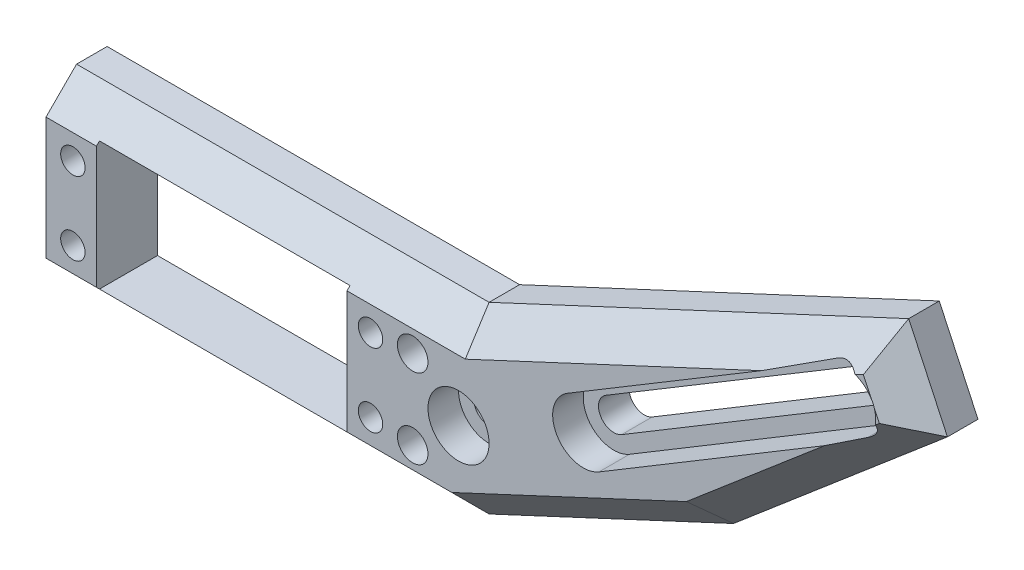
from build123d import *

# Parameters (mm, degrees)
SKETCH1_W                = 57.5
SKETCH1_H                = 30
BOSS_EXTRUDE1_DEPTH      = 30
SKETCH2_W                = 41
SKETCH2_H                = 21
CUT_EXTRUDE1_DEPTH       = 25
SKETCH8_R                = 2
CUT_EXTRUDE6_DEPTH       = 10
SKETCH10_R               = 5
CUT_EXTRUDE8_DEPTH       = 10
BOSS_EXTRUDE4_DEPTH      = 30
SKETCH16_R               = 5
CUT_EXTRUDE10_DEPTH      = 30
CHAMFER5_SIZE            = 5
SKETCH19_R               = 2.5
CUT_EXTRUDE12_DEPTH      = 30
SKETCH20_R               = 7.5
CUT_EXTRUDE13_DEPTH      = 2.5
CUT_EXTRUDE15_DEPTH      = 122.918629513
CUT_EXTRUDE15_DEPTH_BACK = 122.918629513
SKETCH29_W               = 67.5
SKETCH29_H               = 15
CUT_EXTRUDE16_DEPTH      = 124.489525441
CUT_EXTRUDE17_DEPTH      = 5
SKETCH32_R               = 5
CUT_EXTRUDE18_DEPTH      = 5


with BuildPart() as part:
    # Sketch1 → Boss-Extrude1 (new body)
    with BuildSketch(Plane.XY):
        Rectangle(SKETCH1_W, SKETCH1_H)
    extrude(amount=BOSS_EXTRUDE1_DEPTH)

    # Sketch2 → Cut-Extrude1 (cut)
    with BuildSketch(Plane.XY.offset(30)):
        Rectangle(SKETCH2_W, SKETCH2_H)
    extrude(amount=-CUT_EXTRUDE1_DEPTH, mode=Mode.SUBTRACT)

    # Sketch8 → Cut-Extrude6 (cut)
    with BuildSketch(Plane.XY.offset(30)):
        with Locations((24.35, 6)):
            Circle(SKETCH8_R)
        with Locations(Location((24.35, -6, 0), (0, 0, 180))):
            Circle(SKETCH8_R)
        with Locations((-24.35, -6)):
            Circle(SKETCH8_R)
        with Locations(Location((-24.35, 6, 0), (0, 0, 180))):
            Circle(SKETCH8_R)
    extrude(amount=-CUT_EXTRUDE6_DEPTH, mode=Mode.SUBTRACT)

    # Sketch10 → Cut-Extrude8 (cut)
    with BuildSketch(Plane.XY.offset(5)):
        with Locations((-10, 0)):
            Circle(SKETCH10_R)
    extrude(amount=-CUT_EXTRUDE8_DEPTH, mode=Mode.SUBTRACT)

    # Sketch13 → Boss-Extrude4 (add)
    with BuildSketch(Plane.XY.offset(30)):
        Polygon((28.75, 15), (38.75, 15), (107.410726074, 47.017022383), (113.75, 33.422405577), (78.75, 3.652306326), (38.75, -15), (28.75, -15), align=None)
    extrude(amount=-BOSS_EXTRUDE4_DEPTH)

    # Sketch16 → Cut-Extrude10 (cut)
    with BuildSketch(Plane(origin=(1.175656739, -2.521204013, 0), x_dir=(0.9063077870366488, 0.42261826174070183, 0), z_dir=(-0.42261826174070183, 0.9063077870366488, 0))):
        with Locations(Location((97.217429724, -15, 0), (0, 0, 180))):
            Circle(SKETCH16_R)
        with BuildLine():
            Line((67.217429724, -12.5), (82.217429724, -12.5))
            ThreePointArc((82.217429724, -12.5), (84.717429724, -15), (82.217429724, -17.5))
            Line((82.217429724, -17.5), (67.217429724, -17.5))
            ThreePointArc((67.217429724, -17.5), (64.717429724, -15), (67.217429724, -12.5))
        make_face()
    extrude(amount=-CUT_EXTRUDE10_DEPTH, mode=Mode.SUBTRACT)

    # Chamfer5
    # the kernel refuses this chamfer: 5 mm, written as the material it takes off along each edge
    with BuildSketch(Plane(origin=(-28.75, 27.85841494, 0), x_dir=(-0.027495876610586317, 0, 0.9996219169112968), z_dir=(0, -1, 0))) as chamfer5_piece_1:
        Polygon((CHAMFER5_SIZE * 0.999621916911, -CHAMFER5_SIZE * 0.0274958766106), (-CHAMFER5_SIZE * 0.0274958766106, -CHAMFER5_SIZE * 0.999621916911), (0, 0), align=None)
    extrude(amount=55.71682988, mode=Mode.SUBTRACT)
    with BuildSketch(Plane(origin=(-41.60841494, -15, 0), x_dir=(0, -0.027495876610586317, 0.9996219169112968), z_dir=(1, 0, 0)), Plane(origin=(51.60841494, -15, 30), x_dir=(0, -0.027495876610586317, -0.9996219169112968), z_dir=(-1, 0, 0))) as chamfer5_piece_2:
        Polygon((CHAMFER5_SIZE * 0.999621916911, -CHAMFER5_SIZE * 0.0274958766106), (-CHAMFER5_SIZE * 0.0274958766106, -CHAMFER5_SIZE * 0.999621916911), (0, 0), align=None)
    extrude(amount=93.21682988, mode=Mode.SUBTRACT)
    with BuildSketch(Plane(origin=(90.403681589, 9.086507297, 0), x_dir=(0.011620259578202724, -0.024919727083573626, 0.9996219169112968), z_dir=(-0.9063077870366526, -0.4226182617406939, 0)), Plane(origin=(90.403681589, 9.086507297, 30), x_dir=(-0.4224584769229526, 0.905965127389214, 0.02749587661058631), z_dir=(-0.9063077870366526, -0.4226182617406939, 0))) as chamfer5_piece_3:
        Polygon((CHAMFER5_SIZE * 0.999621916911, CHAMFER5_SIZE * 0.0274958766106), (-CHAMFER5_SIZE * 0.0274958766106, CHAMFER5_SIZE * 0.999621916911), (0, 0), align=None)
    extrude(amount=69.851946638, mode=Mode.SUBTRACT)
    with BuildSketch(Plane(origin=(123.544555766, 41.753402643, 0), x_dir=(-0.6476573741944397, 0.7614354223576539, -0.027495876610586414), z_dir=(-0.7617234170999287, -0.6479023351104763, 0))) as chamfer5_piece_4:
        Polygon((CHAMFER5_SIZE * 0.999621916911, -CHAMFER5_SIZE * 0.0274958766106), (-CHAMFER5_SIZE * 0.0274958766106, -CHAMFER5_SIZE * 0.999621916911), (0, 0), align=None)
    extrude(amount=71.665266299, mode=Mode.SUBTRACT)
    with BuildSketch(Plane(origin=(101.976525103, 58.670703972, 0), x_dir=(-0.9059651273892108, -0.42245847692295924, -0.027495876610586344), z_dir=(0.42261826174070055, -0.9063077870366495, 0))) as chamfer5_piece_5:
        Polygon((CHAMFER5_SIZE * 0.999621916911, -CHAMFER5_SIZE * 0.0274958766106), (-CHAMFER5_SIZE * 0.0274958766106, -CHAMFER5_SIZE * 0.999621916911), (0, 0), align=None)
    extrude(amount=40.71682988, mode=Mode.SUBTRACT)
    with BuildSketch(Plane(origin=(27.096318411, 9.565799029, 0), x_dir=(0.4224584769229604, -0.9059651273892103, -0.02749587661058636), z_dir=(0.9063077870366489, 0.4226182617407018, 0))) as chamfer5_piece_6_section:
        Polygon((CHAMFER5_SIZE * 0.999621916911, -CHAMFER5_SIZE * 0.0274958766106), (-CHAMFER5_SIZE * 0.0274958766106, -CHAMFER5_SIZE * 0.999621916911), (0, 0), align=None)
    chamfer5_piece_6 = extrude(amount=101.47555893, mode=Mode.PRIVATE)
    chamfer5_piece_6 = split(chamfer5_piece_6, bisect_by=Plane(origin=(81.150743587, 15, 1.670360501), z_dir=(0, 1, 0)), keep=Keep.TOP, mode=Mode.PRIVATE)
    add(chamfer5_piece_6, mode=Mode.SUBTRACT)
    with BuildSketch(Plane(origin=(-41.60841494, 15, 0), x_dir=(0, -0.9996219169112968, -0.027495876610586372), z_dir=(1, 0, 0))) as chamfer5_piece_7_section:
        Polygon((CHAMFER5_SIZE * 0.999621916911, -CHAMFER5_SIZE * 0.0274958766106), (-CHAMFER5_SIZE * 0.0274958766106, -CHAMFER5_SIZE * 0.999621916911), (0, 0), align=None)
    chamfer5_piece_7 = extrude(amount=93.21682988, mode=Mode.PRIVATE)
    chamfer5_piece_7 = split(chamfer5_piece_7, bisect_by=Plane(origin=(3.719146846, -1.335155097, 1.672660276), z_dir=(-0.4226182617407018, 0.9063077870366489, 0)), keep=Keep.TOP, mode=Mode.PRIVATE)
    add(chamfer5_piece_7, mode=Mode.SUBTRACT)
    with BuildSketch(Plane(origin=(51.60841494, 15, 30), x_dir=(0, -0.9996219169112968, 0.027495876610586317), z_dir=(-1, 0, 0))) as chamfer5_piece_8_section:
        Polygon((CHAMFER5_SIZE * 0.999621916911, -CHAMFER5_SIZE * 0.0274958766106), (-CHAMFER5_SIZE * 0.0274958766106, -CHAMFER5_SIZE * 0.999621916911), (0, 0), align=None)
    chamfer5_piece_8 = extrude(amount=93.21682988, mode=Mode.PRIVATE)
    chamfer5_piece_8 = split(chamfer5_piece_8, bisect_by=Plane(origin=(3.719146846, -1.335155097, 28.327339724), z_dir=(-0.4226182617407018, 0.9063077870366489, 0)), keep=Keep.TOP, mode=Mode.PRIVATE)
    add(chamfer5_piece_8, mode=Mode.SUBTRACT)
    with BuildSketch(Plane(origin=(123.544555766, 41.753402643, 30), x_dir=(-0.6476573741944397, 0.7614354223576539, 0.02749587661058634), z_dir=(-0.7617234170999287, -0.6479023351104763, 0))) as chamfer5_piece_9:
        Polygon((CHAMFER5_SIZE * 0.999621916911, CHAMFER5_SIZE * 0.0274958766106), (-CHAMFER5_SIZE * 0.0274958766106, CHAMFER5_SIZE * 0.999621916911), (0, 0), align=None)
    extrude(amount=71.665266299, mode=Mode.SUBTRACT)
    with BuildSketch(Plane(origin=(27.096318411, 9.565799029, 30), x_dir=(0.4224584769229604, -0.9059651273892103, 0.027495876610586313), z_dir=(0.9063077870366489, 0.4226182617407018, 0))) as chamfer5_piece_10_section:
        Polygon((CHAMFER5_SIZE * 0.999621916911, CHAMFER5_SIZE * 0.0274958766106), (-CHAMFER5_SIZE * 0.0274958766106, CHAMFER5_SIZE * 0.999621916911), (0, 0), align=None)
    chamfer5_piece_10 = extrude(amount=101.47555893, mode=Mode.PRIVATE)
    chamfer5_piece_10 = split(chamfer5_piece_10, bisect_by=Plane(origin=(81.150743587, 15, 28.329639499), z_dir=(0, 1, 0)), keep=Keep.TOP, mode=Mode.PRIVATE)
    add(chamfer5_piece_10, mode=Mode.SUBTRACT)
    with BuildSketch(Plane(origin=(101.976525103, 58.670703972, 30), x_dir=(-0.9059651273892108, -0.42245847692295924, 0.027495876610586337), z_dir=(0.42261826174070055, -0.9063077870366495, 0))) as chamfer5_piece_11:
        Polygon((CHAMFER5_SIZE * 0.999621916911, CHAMFER5_SIZE * 0.0274958766106), (-CHAMFER5_SIZE * 0.0274958766106, CHAMFER5_SIZE * 0.999621916911), (0, 0), align=None)
    extrude(amount=40.71682988, mode=Mode.SUBTRACT)
    with BuildSketch(Plane(origin=(27.096318411, 9.565799029, 0), x_dir=(0.4224584769229604, -0.9059651273892103, -0.02749587661058636), z_dir=(0.9063077870366489, 0.4226182617407018, 0))) as chamfer5_piece_12a_section:
        Polygon((CHAMFER5_SIZE * 0.999621916911, -CHAMFER5_SIZE * 0.0274958766106), (-CHAMFER5_SIZE * 0.0274958766106, -CHAMFER5_SIZE * 0.999621916911), (0, 0), align=None)
    chamfer5_piece_12a = extrude(amount=101.47555893, mode=Mode.PRIVATE)
    chamfer5_piece_12a = split(chamfer5_piece_12a, bisect_by=Plane(origin=(35.512062488, 15, 1.537951212), z_dir=(0, -1, 0)), keep=Keep.TOP, mode=Mode.PRIVATE)
    with BuildSketch(Plane(origin=(-41.60841494, 15, 0), x_dir=(0, -0.9996219169112968, -0.027495876610586372), z_dir=(1, 0, 0))) as chamfer5_piece_12b_section:
        Polygon((CHAMFER5_SIZE * 0.999621916911, -CHAMFER5_SIZE * 0.0274958766106), (-CHAMFER5_SIZE * 0.0274958766106, -CHAMFER5_SIZE * 0.999621916911), (0, 0), align=None)
    chamfer5_piece_12b = extrude(amount=93.21682988, mode=Mode.PRIVATE)
    chamfer5_piece_12b = split(chamfer5_piece_12b, bisect_by=Plane(origin=(41.684567981, 16.368411523, 1.537951212), z_dir=(0.4226182617407018, -0.9063077870366489, 0)), keep=Keep.TOP, mode=Mode.PRIVATE)
    chamfer5_piece_12 = chamfer5_piece_12a & chamfer5_piece_12b
    add(chamfer5_piece_12, mode=Mode.SUBTRACT)
    with BuildSketch(Plane(origin=(27.096318411, 9.565799029, 30), x_dir=(0.4224584769229604, -0.9059651273892103, 0.027495876610586313), z_dir=(0.9063077870366489, 0.4226182617407018, 0))) as chamfer5_piece_13a_section:
        Polygon((CHAMFER5_SIZE * 0.999621916911, CHAMFER5_SIZE * 0.0274958766106), (-CHAMFER5_SIZE * 0.0274958766106, CHAMFER5_SIZE * 0.999621916911), (0, 0), align=None)
    chamfer5_piece_13a = extrude(amount=101.47555893, mode=Mode.PRIVATE)
    chamfer5_piece_13a = split(chamfer5_piece_13a, bisect_by=Plane(origin=(35.512062488, 15, 28.462048788), z_dir=(0, -1, 0)), keep=Keep.TOP, mode=Mode.PRIVATE)
    with BuildSketch(Plane(origin=(51.60841494, 15, 30), x_dir=(0, -0.9996219169112968, 0.027495876610586317), z_dir=(-1, 0, 0))) as chamfer5_piece_13b_section:
        Polygon((CHAMFER5_SIZE * 0.999621916911, -CHAMFER5_SIZE * 0.0274958766106), (-CHAMFER5_SIZE * 0.0274958766106, -CHAMFER5_SIZE * 0.999621916911), (0, 0), align=None)
    chamfer5_piece_13b = extrude(amount=93.21682988, mode=Mode.PRIVATE)
    chamfer5_piece_13b = split(chamfer5_piece_13b, bisect_by=Plane(origin=(41.684567981, 16.368411523, 28.462048788), z_dir=(0.4226182617407018, -0.9063077870366489, 0)), keep=Keep.TOP, mode=Mode.PRIVATE)
    chamfer5_piece_13 = chamfer5_piece_13a & chamfer5_piece_13b
    add(chamfer5_piece_13, mode=Mode.SUBTRACT)

    # Sketch19 → Cut-Extrude12 (cut)
    with BuildSketch(Plane.XY.offset(30)):
        with Locations((38.75, 0)):
            Circle(SKETCH19_R)
        with Locations((31.25, 6.5)):
            Circle(SKETCH19_R)
        with Locations(Location((31.25, -6.5, 0), (0, 0, 180))):
            Circle(SKETCH19_R)
    extrude(amount=-CUT_EXTRUDE12_DEPTH, mode=Mode.SUBTRACT)

    # Sketch20 → Cut-Extrude13 (cut)
    with BuildSketch(Plane.XY.offset(5)):
        with Locations((-10, 0)):
            Circle(SKETCH20_R)
    extrude(amount=-CUT_EXTRUDE13_DEPTH, mode=Mode.SUBTRACT)

    # Sketch29 → Cut-Extrude15 (cut, two sides: drawn at the far end of the back side and taken through both)
    with BuildSketch(Plane(origin=(0, 15, 0), x_dir=(1, 0, 0), z_dir=(0, 1, 0)).offset(-CUT_EXTRUDE15_DEPTH_BACK)):
        with Locations((5, -12.5)):
            Rectangle(SKETCH29_W, SKETCH29_H)
        Polygon((38.75, -20), (113.75, -20), (113.75, 0), (-28.75, 0), (-28.75, -5), (38.75, -5), align=None)
    extrude(amount=CUT_EXTRUDE15_DEPTH + CUT_EXTRUDE15_DEPTH_BACK, mode=Mode.SUBTRACT)

    # Sketch30 → Cut-Extrude16 (cut, through all)
    with BuildSketch(Plane.XY.offset(30)):
        with BuildLine():
            Line((57.868462424, 11.383242603), (100.726827459, 37.135146348))
            ThreePointArc((100.726827459, 37.135146348), (104.157340898, 36.279823284), (103.302017833, 32.849309845))
            Line((103.302017833, 32.849309845), (60.443652798, 7.097406099))
            ThreePointArc((60.443652798, 7.097406099), (57.013139359, 7.952729164), (57.868462424, 11.383242603))
        make_face()
    extrude(amount=-CUT_EXTRUDE16_DEPTH, mode=Mode.SUBTRACT)

    # Sketch31 → Cut-Extrude17 (cut)
    with BuildSketch(Plane.XY.offset(30)):
        with BuildLine():
            Line((104.589613021, 30.706391593), (61.731247986, 4.954487847))
            ThreePointArc((61.731247986, 4.954487847), (54.870221108, 6.665133976), (56.580867236, 13.526160855))
            Line((56.580867236, 13.526160855), (99.439232272, 39.2780646))
            ThreePointArc((99.439232272, 39.2780646), (106.30025915, 37.567418471), (104.589613021, 30.706391593))
        make_face()
    extrude(amount=-CUT_EXTRUDE17_DEPTH, mode=Mode.SUBTRACT)

    # Sketch32 → Cut-Extrude18 (cut)
    with BuildSketch(Plane.XY.offset(30)):
        with Locations((38.75, 0)):
            Circle(SKETCH32_R)
    extrude(amount=-CUT_EXTRUDE18_DEPTH, mode=Mode.SUBTRACT)


solid = part.part
